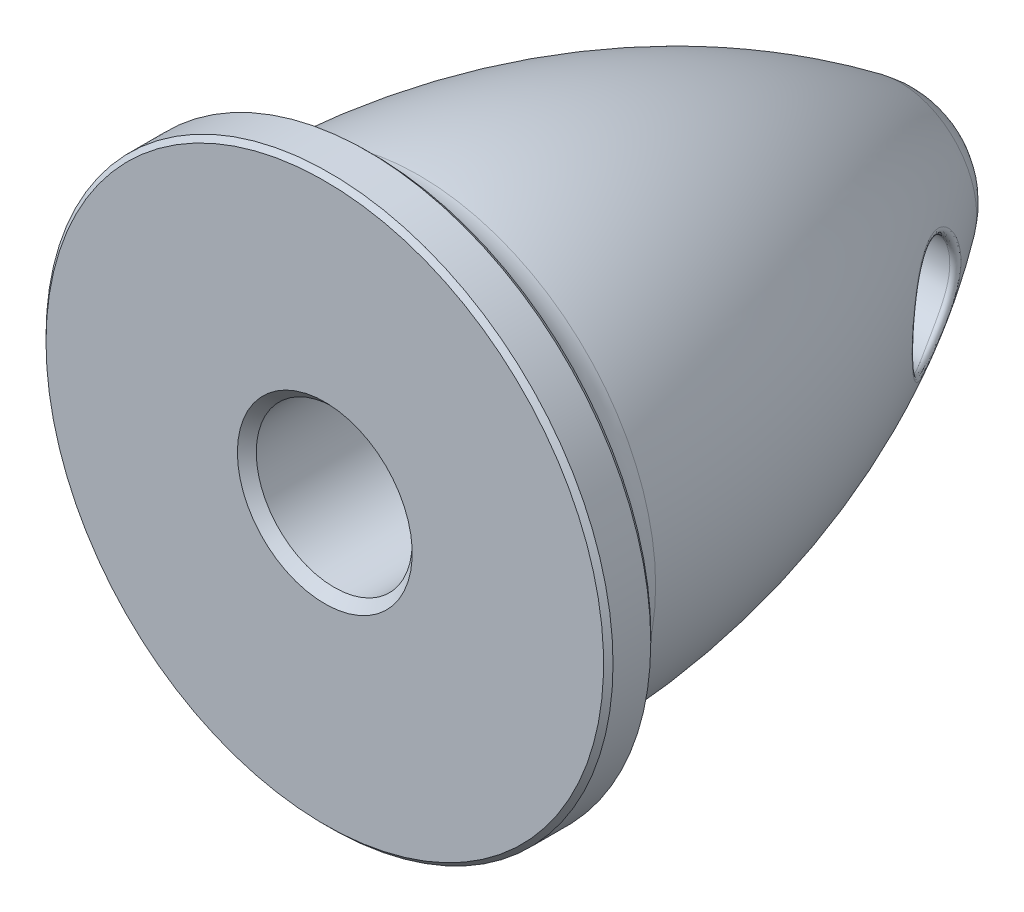
from build123d import *

# Parameters (mm, degrees)
CONG_1_R                                      = 1
CHANFREIN1_SIZE                               = 0.101482527
CHANFREIN1_SIZE_2                             = 0.1
ENL_V_MAT_EXTRU_1_DEPTH                       = 16.524174696
ENL_V_MAT_EXTRU_1_DEPTH_BACK                  = 16.524174696
ESQUISSE2_R                                   = 1
CONG_2_R                                      = 0.1
TROU_POUR_TARAUDAGE_POUR_TROU_TARAUD_M4_D     = 3.3
TROU_POUR_TARAUDAGE_POUR_TROU_TARAUD_M4_DEPTH = 7
TROU_POUR_TARAUDAGE_POUR_TROU_TARAUD_M4_TIP   = 0.991420021
CHANFREIN2_SIZE                               = 0.2


with BuildPart() as part:
    # Esquisse1 → Révolution1 (revolve)
    with BuildSketch(Plane(origin=(0, 0, 0), x_dir=(0, 0, -1), z_dir=(1, 0, 0)), mode=Mode.PRIVATE) as r_volution1_sk:
        with BuildLine():
            Line((0, 0), (0, 6))
            Line((0, 6), (1, 6))
            Line((1, 6), (1, 5))
            ThreePointArc((1, 5), (6.877331854, 4.257626479), (12.179402793, 1.615242722))
            ThreePointArc((12.179402793, 1.615242722), (12.783087994, 0.905868206), (13, 0))
            Line((13, 0), (11, 0))
            Line((11, 0), (0, 0))
        make_face()
    revolve(r_volution1_sk.sketch.rotate(Axis((0, 0, 1000), (0, 0, -1)), 90), axis=Axis((0, 0, 1000), (0, 0, -1)))

    # Congé1
    # the kernel refuses this fillet: 1 mm, written as the material it adds along each edge
    with BuildSketch(Plane(origin=(0, 0, -1), x_dir=(1, 0, 0), z_dir=(0, 1, 0))) as cong_1_piece_1_section:
        with BuildLine():
            CenterArc((6.014503514, 1), CONG_1_R, 180.752635343, 89.247364657)
            ThreePointArc((5.01458979, 0.986864413), (5.014183378, 0.493330367), (5, 0))
            Line((5, 0), (6.014503514, 0))
        make_face()
    cong_1_piece_1 = revolve(axis=Axis((0, 0, -1), (0, 0, -1)), mode=Mode.PRIVATE)
    cong_1_piece_1 = cong_1_piece_1 & Plane(origin=(0, 0, -1), x_dir=(1, 0, 0), z_dir=(0, 0, -1)) * Cylinder(6, 25, mode=Mode.PRIVATE)
    add(cong_1_piece_1)

    # Chanfrein1
    # the kernel refuses this chamfer: 0.101482527, 0.1 mm, written as the material it takes off along each edge
    with BuildSketch(Plane(origin=(0, 0, -1.000105181), x_dir=(1, 0, 0), z_dir=(0, 1, 0))) as chanfrein1_piece_1:
        with BuildLine():
            Line((5.894501906, 0.007121121), (6, -CHANFREIN1_SIZE * 1.00000000364))
            Line((6, -CHANFREIN1_SIZE * 1.00000000364), (6, 0))
            ThreePointArc((6, 0), (5.94564706, 0.002268241), (5.894501906, 0.007121121))
        make_face()
    revolve(axis=Axis((0, 0, -1.000105181), (0, 0, -1)), mode=Mode.SUBTRACT)
    with BuildSketch(Plane(origin=(0, 0, 0), x_dir=(1, 0, 0), z_dir=(0, 1, 0))) as chanfrein1_piece_2:
        Polygon((6, CHANFREIN1_SIZE_2), (6 - CHANFREIN1_SIZE_2, 0), (6, 0), align=None)
    revolve(axis=Axis((0, 0, 0), (0, 0, -1)), mode=Mode.SUBTRACT)

    # Esquisse2 → Enlèv. mat.-Extru.1 (cut, two sides: drawn at the far end of the back side and taken through both)
    with BuildSketch(Plane(origin=(0, 0, 0), x_dir=(0, 0, -1), z_dir=(1, 0, 0)).offset(-ENL_V_MAT_EXTRU_1_DEPTH_BACK)):
        with Locations(Location((10, 0, 0), (0, 0, 359.999999734))):
            Circle(ESQUISSE2_R)
    extrude(amount=ENL_V_MAT_EXTRU_1_DEPTH + ENL_V_MAT_EXTRU_1_DEPTH_BACK, mode=Mode.SUBTRACT)

    # Congé2
    cong_2_edges = [part.edges().sort_by_distance(p)[0] for p in [
        (2.823077701, 0.999326778, -9.963311744),
        (-3.463147639, 4e-09, -8.999999997),
    ]]
    fillet(cong_2_edges, radius=CONG_2_R)

    # Trou pour taraudage pour trou taraudé M41
    with Locations(Plane.XY):
        with Locations((0, 0)):
            Hole(TROU_POUR_TARAUDAGE_POUR_TROU_TARAUD_M4_D / 2, depth=TROU_POUR_TARAUDAGE_POUR_TROU_TARAUD_M4_DEPTH)
            with Locations((0, 0, -(TROU_POUR_TARAUDAGE_POUR_TROU_TARAUD_M4_DEPTH + TROU_POUR_TARAUDAGE_POUR_TROU_TARAUD_M4_TIP / 2))):  # 118° drill point
                Cone(0, TROU_POUR_TARAUDAGE_POUR_TROU_TARAUD_M4_D / 2, TROU_POUR_TARAUDAGE_POUR_TROU_TARAUD_M4_TIP, mode=Mode.SUBTRACT)

    # Chanfrein2
    chanfrein2_edges = [part.edges().sort_by_distance(p)[0] for p in [
        (1.65, 0, 0),
    ]]
    chamfer(chanfrein2_edges, length=CHANFREIN2_SIZE)


solid = part.part
